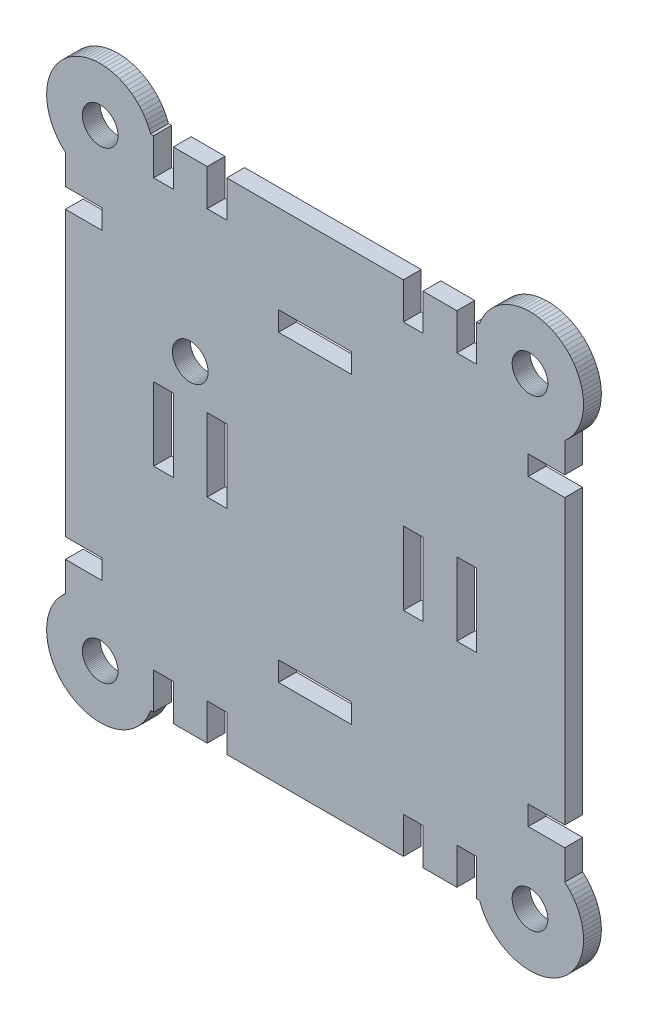
from build123d import *

# Parameters (mm, degrees)
SKETCH2_W           = 20.5
SKETCH2_H           = 5.5
SKETCH2_W_2         = 5.5
SKETCH2_H_2         = 20.5
BOSS_EXTRUDE1_DEPTH = 2.5


with BuildPart() as part:
    # Sketch2 → Boss-Extrude1 (new, symmetric)
    with BuildSketch(Plane.XY):
        Polygon((-871.204347808, -72.297002289), (-871.204347808, -82.547002289), (-876.704347808, -82.547002289), (-876.704347808, -72.297002289), (-886.204347808, -72.296999745), (-886.204347808, -82.546999745), (-891.704347808, -82.546999745), (-891.704347808, -72.296999745), (-892.561694294, -72.296999745), (-892.926008435, -71.366433336), (-893.351476413, -70.462190207), (-893.836209757, -69.588283907), (-894.378056942, -68.748593331), (-894.974612943, -67.946845506), (-895.623229901, -67.186599048), (-896.321028884, -66.471228364), (-897.064912661, -65.803908679), (-897.851579451, -65.18760194), (-898.677537577, -64.625043667), (-899.539120964, -64.118730816), (-900.432505413, -63.670910693), (-901.353725572, -63.283570979), (-902.298692541, -62.958430911), (-903.263212015, -62.696933644), (-904.243002905, -62.500239855), (-905.23371634, -62.369222581), (-906.230954967, -62.304463353), (-907.23029247, -62.306249609), (-908.227293219, -62.374573421), (-909.217531953, -62.509131529), (-910.196613428, -62.709326687), (-911.160191921, -62.974270313), (-912.103990518, -63.302786438), (-913.023820102, -63.693416918), (-913.915597944, -64.144427912), (-914.775365823, -64.653817576), (-915.599307598, -65.219324947), (-916.383766146, -65.83843998), (-917.125259589, -66.508414688), (-917.820496756, -67.226275341), (-918.466391788, -67.988835663), (-919.060077832, -68.792710974), (-919.598919771, -69.634333218), (-920.080525916, -70.509966792), (-920.502758624, -71.415725135), (-920.863743785, -72.347587974), (-921.161879139, -73.301419168), (-921.395841393, -74.272985069), (-921.564592087, -75.257973312), (-921.667382209, -76.252011957), (-921.703755519, -77.25068889), (-921.67355057, -78.249571415), (-921.57690143, -79.244225917), (-921.414237083, -80.230237553), (-921.186279526, -81.203229839), (-920.894040564, -82.158884078), (-920.538817322, -83.092958532), (-920.122186484, -84.001307243), (-919.645997295, -84.87989844), (-919.112363355, -85.724832434), (-918.523653237, -86.532358924), (-917.882479972, -87.298893647), (-917.191689455, -88.021034282), (-916.45434999, -88.695573691), (-916.454347808, -97.047001017), (-906.204347808, -97.047001017), (-906.204347808, -102.547001017), (-916.454347808, -102.547001017), (-916.454347808, -182.047003561), (-906.204347808, -182.047003561), (-906.204347808, -187.547003561), (-916.454347808, -187.547003561), (-916.45434999, -195.898430887), (-917.191689455, -196.572970296), (-917.882479972, -197.295110931), (-918.523653237, -198.061645654), (-919.112363355, -198.869172144), (-919.645997295, -199.714106138), (-920.122186484, -200.592697336), (-920.538817322, -201.501046047), (-920.894040564, -202.4351205), (-921.186279526, -203.39077474), (-921.414237083, -204.363767025), (-921.57690143, -205.349778661), (-921.67355057, -206.344433164), (-921.703755519, -207.343315688), (-921.667382209, -208.341992622), (-921.564592087, -209.336031266), (-921.395841393, -210.32101951), (-921.161879139, -211.292585411), (-920.863743785, -212.246416604), (-920.502758624, -213.178279443), (-920.080525916, -214.084037786), (-919.598919771, -214.959671361), (-919.060077832, -215.801293604), (-918.466391788, -216.605168916), (-917.820496756, -217.367729237), (-917.125259589, -218.08558989), (-916.383766146, -218.755564599), (-915.599307598, -219.374679631), (-914.775365823, -219.940187002), (-913.915597944, -220.449576666), (-913.023820102, -220.90058766), (-912.103990518, -221.291218141), (-911.160191921, -221.619734265), (-910.196613428, -221.884677892), (-909.217531953, -222.084873049), (-908.227293219, -222.219431157), (-907.23029247, -222.287754969), (-906.230954967, -222.289541225), (-905.23371634, -222.224781997), (-904.243002905, -222.093764724), (-903.263212015, -221.897070934), (-902.298692541, -221.635573668), (-901.353725572, -221.310433599), (-900.432505413, -220.923093886), (-899.539120964, -220.475273763), (-898.677537577, -219.968960912), (-897.851579451, -219.406402639), (-897.064912661, -218.790095899), (-896.321028884, -218.122776214), (-895.623229901, -217.40740553), (-894.974612943, -216.647159072), (-894.378056942, -215.845411247), (-893.836209757, -215.005720671), (-893.351476413, -214.131814371), (-892.926008435, -213.227571242), (-892.561694294, -212.297004833), (-891.704347808, -212.297004833), (-891.704347808, -202.047004833), (-886.204347808, -202.047004833), (-886.204347808, -212.297004833), (-876.704347808, -212.297002289), (-876.704347808, -202.047002289), (-871.204347808, -202.047002289), (-871.204347808, -212.297002289), (-821.704354274, -212.297004833), (-821.704354274, -202.047004833), (-816.204354274, -202.047004833), (-816.204354274, -212.297004833), (-806.704354274, -212.297004833), (-806.704354274, -202.047004833), (-801.204354274, -202.047004833), (-801.204354274, -212.297004833), (-800.347007789, -212.297004833), (-799.982693647, -213.227571242), (-799.55722567, -214.131814371), (-799.072492326, -215.005720671), (-798.53064514, -215.845411247), (-797.93408914, -216.647159072), (-797.285472182, -217.40740553), (-796.587673199, -218.122776214), (-795.843789422, -218.790095899), (-795.057122632, -219.406402639), (-794.231164506, -219.968960912), (-793.369581119, -220.475273763), (-792.47619667, -220.923093886), (-791.55497651, -221.310433599), (-790.610009542, -221.635573668), (-789.645490068, -221.897070934), (-788.665699177, -222.093764724), (-787.674985742, -222.224781997), (-786.677747116, -222.289541225), (-785.678409613, -222.287754969), (-784.681408864, -222.219431157), (-783.691170129, -222.084873049), (-782.712088654, -221.884677892), (-781.748510162, -221.619734265), (-780.804711565, -221.291218141), (-779.884881981, -220.90058766), (-778.993104139, -220.449576666), (-778.13333626, -219.940187002), (-777.309394484, -219.374679631), (-776.524935937, -218.755564599), (-775.783442494, -218.08558989), (-775.088205327, -217.367729237), (-774.442310295, -216.605168916), (-773.848624251, -215.801293604), (-773.309782311, -214.959671361), (-772.828176166, -214.084037786), (-772.405943458, -213.178279443), (-772.044958298, -212.246416604), (-771.746822943, -211.292585411), (-771.51286069, -210.32101951), (-771.344109996, -209.336031266), (-771.241319874, -208.341992622), (-771.204946564, -207.343315688), (-771.235151512, -206.344433164), (-771.331800652, -205.349778661), (-771.494465, -204.363767025), (-771.722422557, -203.39077474), (-772.014661518, -202.4351205), (-772.36988476, -201.501046047), (-772.786515599, -200.592697336), (-773.262704788, -199.714106138), (-773.796338727, -198.869172144), (-774.385048846, -198.061645654), (-775.02622211, -197.295110932), (-775.717012627, -196.572970296), (-776.454354274, -195.898429021), (-776.454354274, -187.547003561), (-786.704354274, -187.547003561), (-786.704354274, -182.047003561), (-776.454354274, -182.047003561), (-776.454354274, -102.547001017), (-786.704354274, -102.547001017), (-786.704354274, -97.047001017), (-776.454354274, -97.047001017), (-776.454354274, -88.695575557), (-775.717012627, -88.021034282), (-775.02622211, -87.298893647), (-774.385048846, -86.532358924), (-773.796338727, -85.724832434), (-773.262704788, -84.87989844), (-772.786515599, -84.001307243), (-772.36988476, -83.092958532), (-772.014661518, -82.158884078), (-771.722422557, -81.203229839), (-771.494465, -80.230237553), (-771.331800652, -79.244225917), (-771.235151512, -78.249571415), (-771.204946564, -77.25068889), (-771.241319874, -76.252011956), (-771.344109996, -75.257973312), (-771.51286069, -74.272985069), (-771.746822943, -73.301419168), (-772.044958298, -72.347587974), (-772.405943458, -71.415725135), (-772.828176166, -70.509966792), (-773.309782311, -69.634333218), (-773.848624251, -68.792710974), (-774.442310295, -67.988835663), (-775.088205327, -67.226275341), (-775.783442494, -66.508414688), (-776.524935937, -65.83843998), (-777.309394484, -65.219324947), (-778.13333626, -64.653817576), (-778.993104139, -64.144427912), (-779.884881981, -63.693416918), (-780.804711565, -63.302786438), (-781.748510162, -62.974270313), (-782.712088654, -62.709326687), (-783.691170129, -62.509131529), (-784.681408864, -62.374573421), (-785.678409613, -62.306249609), (-786.677747116, -62.304463353), (-787.674985742, -62.369222581), (-788.665699177, -62.500239855), (-789.645490068, -62.696933644), (-790.610009542, -62.958430911), (-791.55497651, -63.283570979), (-792.47619667, -63.670910693), (-793.369581119, -64.118730816), (-794.231164506, -64.625043667), (-795.057122632, -65.18760194), (-795.843789422, -65.803908679), (-796.587673199, -66.471228364), (-797.285472182, -67.186599048), (-797.93408914, -67.946845506), (-798.53064514, -68.748593331), (-799.072492326, -69.588283907), (-799.55722567, -70.462190207), (-799.982693647, -71.366433336), (-800.347007789, -72.296999745), (-801.204354274, -72.296999745), (-801.204354274, -82.546999745), (-806.704354274, -82.546999745), (-806.704354274, -72.296999745), (-816.204354274, -72.296999745), (-816.204354274, -82.546999745), (-821.704354274, -82.546999745), (-821.704354274, -72.296999745), align=None)
        with Locations((-846.454351041, -99.797001017)):
            Rectangle(SKETCH2_W, SKETCH2_H, mode=Mode.SUBTRACT)
        with Locations((-873.954347808, -142.297002289)):
            Rectangle(SKETCH2_W_2, SKETCH2_H_2, mode=Mode.SUBTRACT)
        with Locations((-888.954347808, -142.297002289)):
            Rectangle(SKETCH2_W_2, SKETCH2_H_2, mode=Mode.SUBTRACT)
        with Locations((-818.954354274, -142.296999745)):
            Rectangle(SKETCH2_W_2, SKETCH2_H_2, mode=Mode.SUBTRACT)
        with Locations((-803.954354274, -142.296999745)):
            Rectangle(SKETCH2_W_2, SKETCH2_H_2, mode=Mode.SUBTRACT)
        with Locations((-846.454351041, -184.797003561)):
            Rectangle(SKETCH2_W, SKETCH2_H, mode=Mode.SUBTRACT)
        Polygon((-886.443642425, -122.374017935), (-886.454347808, -122.047002289), (-886.443642425, -121.719986643), (-886.411572115, -121.394371328), (-886.35827421, -121.071550679), (-886.28397694, -120.752907064), (-886.188998456, -120.439804963), (-886.073745471, -120.133585127), (-885.938711516, -119.835558838), (-885.784474827, -119.547002289), (-885.61169587, -119.269151124), (-885.42111451, -119.003195144), (-885.213546846, -118.750273214), (-884.989881714, -118.511468383), (-884.751076884, -118.287803252), (-884.498154953, -118.080235588), (-884.232198974, -117.889654228), (-883.954347808, -117.71687527), (-883.66579126, -117.562638582), (-883.36776497, -117.427604627), (-883.061545135, -117.312351642), (-882.748443034, -117.217373158), (-882.429799418, -117.143075887), (-882.10697877, -117.089777982), (-881.781363455, -117.057707673), (-881.454347808, -117.047002289), (-881.127332162, -117.057707673), (-880.801716847, -117.089777982), (-880.478896198, -117.143075887), (-880.160252583, -117.217373158), (-879.847150482, -117.312351642), (-879.540930647, -117.427604627), (-879.242904357, -117.562638582), (-878.954347808, -117.71687527), (-878.676496643, -117.889654228), (-878.410540663, -118.080235588), (-878.157618733, -118.287803252), (-877.918813902, -118.511468383), (-877.695148771, -118.750273214), (-877.487581107, -119.003195144), (-877.296999747, -119.269151124), (-877.124220789, -119.547002289), (-876.969984101, -119.835558838), (-876.834950146, -120.133585127), (-876.719697161, -120.439804963), (-876.624718677, -120.752907064), (-876.550421406, -121.071550679), (-876.497123502, -121.394371328), (-876.465053192, -121.719986643), (-876.454347808, -122.047002289), (-876.465053192, -122.374017935), (-876.497123502, -122.69963325), (-876.550421406, -123.022453899), (-876.624718677, -123.341097515), (-876.719697161, -123.654199616), (-876.834950146, -123.960419451), (-876.969984101, -124.25844574), (-877.124220789, -124.547002289), (-877.296999747, -124.824853454), (-877.487581107, -125.090809434), (-877.695148771, -125.343731365), (-877.918813902, -125.582536195), (-878.157618733, -125.806201327), (-878.410540663, -126.013768991), (-878.676496643, -126.204350351), (-878.954347808, -126.377129308), (-879.242904357, -126.531365997), (-879.540930647, -126.666399952), (-879.847150482, -126.781652937), (-880.160252583, -126.876631421), (-880.478896198, -126.950928691), (-880.801716847, -127.004226596), (-881.127332162, -127.036296905), (-881.454347808, -127.047002289), (-881.781363455, -127.036296905), (-882.10697877, -127.004226596), (-882.429799418, -126.950928691), (-882.748443034, -126.876631421), (-883.061545135, -126.781652937), (-883.36776497, -126.666399952), (-883.66579126, -126.531365997), (-883.954347808, -126.377129308), (-884.232198974, -126.204350351), (-884.498154953, -126.013768991), (-884.751076884, -125.806201327), (-884.989881714, -125.582536195), (-885.213546846, -125.343731365), (-885.42111451, -125.090809434), (-885.61169587, -124.824853454), (-885.784474827, -124.547002289), (-885.938711516, -124.25844574), (-886.073745471, -123.960419451), (-886.188998456, -123.654199616), (-886.28397694, -123.341097515), (-886.35827421, -123.022453899), (-886.411572115, -122.69963325), align=None, mode=Mode.SUBTRACT)
        Polygon((-788.11829221, -72.677610238), (-787.812072375, -72.562357253), (-787.498970274, -72.467378769), (-787.180326659, -72.393081499), (-786.85750601, -72.339783594), (-786.531890695, -72.307713284), (-786.204875049, -72.297007901), (-785.877859403, -72.307713284), (-785.552244088, -72.339783594), (-785.229423439, -72.393081499), (-784.910779823, -72.467378769), (-784.597677722, -72.562357253), (-784.291457887, -72.677610238), (-783.993431598, -72.812644193), (-783.704875049, -72.966880882), (-783.427023884, -73.139659839), (-783.161067904, -73.330241199), (-782.908145973, -73.537808863), (-782.669341143, -73.761473995), (-782.445676011, -74.000278825), (-782.238108347, -74.253200756), (-782.047526987, -74.519156735), (-781.87474803, -74.797007901), (-781.720511341, -75.085564449), (-781.585477386, -75.383590739), (-781.470224401, -75.689810574), (-781.375245917, -76.002912675), (-781.300948647, -76.32155629), (-781.247650742, -76.644376939), (-781.215580432, -76.969992254), (-781.204875049, -77.297007901), (-781.215580432, -77.624023547), (-781.247650742, -77.949638862), (-781.300948647, -78.272459511), (-781.375245917, -78.591103126), (-781.470224401, -78.904205227), (-781.585477386, -79.210425062), (-781.720511341, -79.508451352), (-781.87474803, -79.797007901), (-782.047526987, -80.074859066), (-782.238108347, -80.340815046), (-782.445676011, -80.593736976), (-782.669341143, -80.832541807), (-782.908145973, -81.056206938), (-783.161067904, -81.263774602), (-783.427023884, -81.454355962), (-783.704875049, -81.62713492), (-783.993431598, -81.781371608), (-784.291457887, -81.916405563), (-784.597677722, -82.031658548), (-784.910779823, -82.126637032), (-785.229423439, -82.200934303), (-785.552244088, -82.254232207), (-785.877859403, -82.286302517), (-786.204875049, -82.297007901), (-786.531890695, -82.286302517), (-786.85750601, -82.254232207), (-787.180326659, -82.200934303), (-787.498970274, -82.126637032), (-787.812072375, -82.031658548), (-788.11829221, -81.916405563), (-788.4163185, -81.781371608), (-788.704875049, -81.62713492), (-788.982726214, -81.454355962), (-789.248682194, -81.263774602), (-789.501604124, -81.056206938), (-789.740408955, -80.832541807), (-789.964074086, -80.593736976), (-790.17164175, -80.340815046), (-790.36222311, -80.074859066), (-790.535002068, -79.797007901), (-790.689238756, -79.508451352), (-790.824272711, -79.210425062), (-790.939525696, -78.904205227), (-791.03450418, -78.591103126), (-791.108801451, -78.272459511), (-791.162099356, -77.949638862), (-791.194169665, -77.624023547), (-791.204875049, -77.297007901), (-791.194169665, -76.969992254), (-791.162099356, -76.644376939), (-791.108801451, -76.32155629), (-791.03450418, -76.002912675), (-790.939525696, -75.689810574), (-790.824272711, -75.383590739), (-790.689238756, -75.085564449), (-790.535002068, -74.797007901), (-790.36222311, -74.519156735), (-790.17164175, -74.253200756), (-789.964074086, -74.000278825), (-789.740408955, -73.761473995), (-789.501604124, -73.537808863), (-789.248682194, -73.330241199), (-788.982726214, -73.139659839), (-788.704875049, -72.966880882), (-788.4163185, -72.812644193), align=None, mode=Mode.SUBTRACT)
        Polygon((-791.108801451, -206.321545068), (-791.03450418, -206.002901452), (-790.939525696, -205.689799351), (-790.824272711, -205.383579516), (-790.689238756, -205.085553227), (-790.535002068, -204.796996678), (-790.36222311, -204.519145513), (-790.17164175, -204.253189533), (-789.964074086, -204.000267602), (-789.740408955, -203.761462772), (-789.501604124, -203.53779764), (-789.248682194, -203.330229976), (-788.982726214, -203.139648616), (-788.704875049, -202.966869659), (-788.4163185, -202.81263297), (-788.11829221, -202.677599015), (-787.812072375, -202.56234603), (-787.498970274, -202.467367546), (-787.180326659, -202.393070276), (-786.85750601, -202.339772371), (-786.531890695, -202.307702062), (-786.204875049, -202.296996678), (-785.877859403, -202.307702062), (-785.552244088, -202.339772371), (-785.229423439, -202.393070276), (-784.910779823, -202.467367546), (-784.597677722, -202.56234603), (-784.291457887, -202.677599015), (-783.993431598, -202.81263297), (-783.704875049, -202.966869659), (-783.427023884, -203.139648616), (-783.161067904, -203.330229976), (-782.908145973, -203.53779764), (-782.669341143, -203.761462772), (-782.445676011, -204.000267602), (-782.238108347, -204.253189533), (-782.047526987, -204.519145513), (-781.87474803, -204.796996678), (-781.720511341, -205.085553227), (-781.585477386, -205.383579516), (-781.470224401, -205.689799351), (-781.375245917, -206.002901452), (-781.300948647, -206.321545068), (-781.247650742, -206.644365717), (-781.215580432, -206.969981032), (-781.204875049, -207.296996678), (-781.215580432, -207.624012324), (-781.247650742, -207.949627639), (-781.300948647, -208.272448288), (-781.375245917, -208.591091903), (-781.470224401, -208.904194004), (-781.585477386, -209.21041384), (-781.720511341, -209.508440129), (-781.87474803, -209.796996678), (-782.047526987, -210.074847843), (-782.238108347, -210.340803823), (-782.445676011, -210.593725753), (-782.669341143, -210.832530584), (-782.908145973, -211.056195715), (-783.161067904, -211.263763379), (-783.427023884, -211.454344739), (-783.704875049, -211.627123697), (-783.993431598, -211.781360385), (-784.291457887, -211.91639434), (-784.597677722, -212.031647325), (-784.910779823, -212.126625809), (-785.229423439, -212.20092308), (-785.552244088, -212.254220985), (-785.877859403, -212.286291294), (-786.204875049, -212.296996678), (-786.531890695, -212.286291294), (-786.85750601, -212.254220985), (-787.180326659, -212.20092308), (-787.498970274, -212.126625809), (-787.812072375, -212.031647325), (-788.11829221, -211.91639434), (-788.4163185, -211.781360385), (-788.704875049, -211.627123697), (-788.982726214, -211.454344739), (-789.248682194, -211.263763379), (-789.501604124, -211.056195715), (-789.740408955, -210.832530584), (-789.964074086, -210.593725753), (-790.17164175, -210.340803823), (-790.36222311, -210.074847843), (-790.535002068, -209.796996678), (-790.689238756, -209.508440129), (-790.824272711, -209.21041384), (-790.939525696, -208.904194004), (-791.03450418, -208.591091903), (-791.108801451, -208.272448288), (-791.162099356, -207.949627639), (-791.194169665, -207.624012324), (-791.204875049, -207.296996678), (-791.194169665, -206.969981032), (-791.162099356, -206.644365717), align=None, mode=Mode.SUBTRACT)
        Polygon((-911.69312165, -207.624012324), (-911.703827034, -207.296996678), (-911.69312165, -206.969981032), (-911.661051341, -206.644365717), (-911.607753436, -206.321545068), (-911.533456165, -206.002901452), (-911.438477681, -205.689799351), (-911.323224697, -205.383579516), (-911.188190742, -205.085553227), (-911.033954053, -204.796996678), (-910.861175096, -204.519145513), (-910.670593735, -204.253189533), (-910.463026071, -204.000267602), (-910.23936094, -203.761462772), (-910.00055611, -203.53779764), (-909.747634179, -203.330229976), (-909.481678199, -203.139648616), (-909.203827034, -202.966869659), (-908.915270485, -202.81263297), (-908.617244196, -202.677599015), (-908.311024361, -202.56234603), (-907.99792226, -202.467367546), (-907.679278644, -202.393070276), (-907.356457995, -202.339772371), (-907.03084268, -202.307702062), (-906.703827034, -202.296996678), (-906.376811388, -202.307702062), (-906.051196073, -202.339772371), (-905.728375424, -202.393070276), (-905.409731808, -202.467367546), (-905.096629707, -202.56234603), (-904.790409872, -202.677599015), (-904.492383583, -202.81263297), (-904.203827034, -202.966869659), (-903.925975869, -203.139648616), (-903.660019889, -203.330229976), (-903.407097959, -203.53779764), (-903.168293128, -203.761462772), (-902.944627997, -204.000267602), (-902.737060333, -204.253189533), (-902.546478972, -204.519145513), (-902.373700015, -204.796996678), (-902.219463326, -205.085553227), (-902.084429371, -205.383579516), (-901.969176387, -205.689799351), (-901.874197903, -206.002901452), (-901.799900632, -206.321545068), (-901.746602727, -206.644365717), (-901.714532418, -206.969981032), (-901.703827034, -207.296996678), (-901.714532418, -207.624012324), (-901.746602727, -207.949627639), (-901.799900632, -208.272448288), (-901.874197903, -208.591091903), (-901.969176387, -208.904194004), (-902.084429371, -209.21041384), (-902.219463326, -209.508440129), (-902.373700015, -209.796996678), (-902.546478972, -210.074847843), (-902.737060333, -210.340803823), (-902.944627997, -210.593725753), (-903.168293128, -210.832530584), (-903.407097959, -211.056195715), (-903.660019889, -211.263763379), (-903.925975869, -211.454344739), (-904.203827034, -211.627123697), (-904.492383583, -211.781360385), (-904.790409872, -211.91639434), (-905.096629707, -212.031647325), (-905.409731808, -212.126625809), (-905.728375424, -212.20092308), (-906.051196073, -212.254220985), (-906.376811388, -212.286291294), (-906.703827034, -212.296996678), (-907.03084268, -212.286291294), (-907.356457995, -212.254220985), (-907.679278644, -212.20092308), (-907.99792226, -212.126625809), (-908.311024361, -212.031647325), (-908.617244196, -211.91639434), (-908.915270485, -211.781360385), (-909.203827034, -211.627123697), (-909.481678199, -211.454344739), (-909.747634179, -211.263763379), (-910.00055611, -211.056195715), (-910.23936094, -210.832530584), (-910.463026071, -210.593725753), (-910.670593735, -210.340803823), (-910.861175096, -210.074847843), (-911.033954053, -209.796996678), (-911.188190742, -209.508440129), (-911.323224697, -209.21041384), (-911.438477681, -208.904194004), (-911.533456165, -208.591091903), (-911.607753436, -208.272448288), (-911.661051341, -207.949627639), align=None, mode=Mode.SUBTRACT)
        Polygon((-911.533456165, -76.002912675), (-911.438477681, -75.689810574), (-911.323224697, -75.383590739), (-911.188190742, -75.085564449), (-911.033954053, -74.797007901), (-910.861175096, -74.519156735), (-910.670593735, -74.253200756), (-910.463026071, -74.000278825), (-910.23936094, -73.761473995), (-910.00055611, -73.537808863), (-909.747634179, -73.330241199), (-909.481678199, -73.139659839), (-909.203827034, -72.966880882), (-908.915270485, -72.812644193), (-908.617244196, -72.677610238), (-908.311024361, -72.562357253), (-907.99792226, -72.467378769), (-907.679278644, -72.393081499), (-907.356457995, -72.339783594), (-907.03084268, -72.307713284), (-906.703827034, -72.297007901), (-906.376811388, -72.307713284), (-906.051196073, -72.339783594), (-905.728375424, -72.393081499), (-905.409731808, -72.467378769), (-905.096629707, -72.562357253), (-904.790409872, -72.677610238), (-904.492383583, -72.812644193), (-904.203827034, -72.966880882), (-903.925975869, -73.139659839), (-903.660019889, -73.330241199), (-903.407097959, -73.537808863), (-903.168293128, -73.761473995), (-902.944627997, -74.000278825), (-902.737060333, -74.253200756), (-902.546478972, -74.519156735), (-902.373700015, -74.797007901), (-902.219463326, -75.085564449), (-902.084429371, -75.383590739), (-901.969176387, -75.689810574), (-901.874197903, -76.002912675), (-901.799900632, -76.32155629), (-901.746602727, -76.644376939), (-901.714532418, -76.969992254), (-901.703827034, -77.297007901), (-901.714532418, -77.624023547), (-901.746602727, -77.949638862), (-901.799900632, -78.272459511), (-901.874197903, -78.591103126), (-901.969176387, -78.904205227), (-902.084429371, -79.210425062), (-902.219463326, -79.508451352), (-902.373700015, -79.797007901), (-902.546478972, -80.074859066), (-902.737060333, -80.340815046), (-902.944627997, -80.593736976), (-903.168293128, -80.832541807), (-903.407097959, -81.056206938), (-903.660019889, -81.263774602), (-903.925975869, -81.454355962), (-904.203827034, -81.62713492), (-904.492383583, -81.781371608), (-904.790409872, -81.916405563), (-905.096629707, -82.031658548), (-905.409731808, -82.126637032), (-905.728375424, -82.200934303), (-906.051196073, -82.254232207), (-906.376811388, -82.286302517), (-906.703827034, -82.297007901), (-907.03084268, -82.286302517), (-907.356457995, -82.254232207), (-907.679278644, -82.200934303), (-907.99792226, -82.126637032), (-908.311024361, -82.031658548), (-908.617244196, -81.916405563), (-908.915270485, -81.781371608), (-909.203827034, -81.62713492), (-909.481678199, -81.454355962), (-909.747634179, -81.263774602), (-910.00055611, -81.056206938), (-910.23936094, -80.832541807), (-910.463026071, -80.593736976), (-910.670593735, -80.340815046), (-910.861175096, -80.074859066), (-911.033954053, -79.797007901), (-911.188190742, -79.508451352), (-911.323224697, -79.210425062), (-911.438477681, -78.904205227), (-911.533456165, -78.591103126), (-911.607753436, -78.272459511), (-911.661051341, -77.949638862), (-911.69312165, -77.624023547), (-911.703827034, -77.297007901), (-911.69312165, -76.969992254), (-911.661051341, -76.644376939), (-911.607753436, -76.32155629), align=None, mode=Mode.SUBTRACT)
    extrude(amount=BOSS_EXTRUDE1_DEPTH, both=True)


solid = part.part
